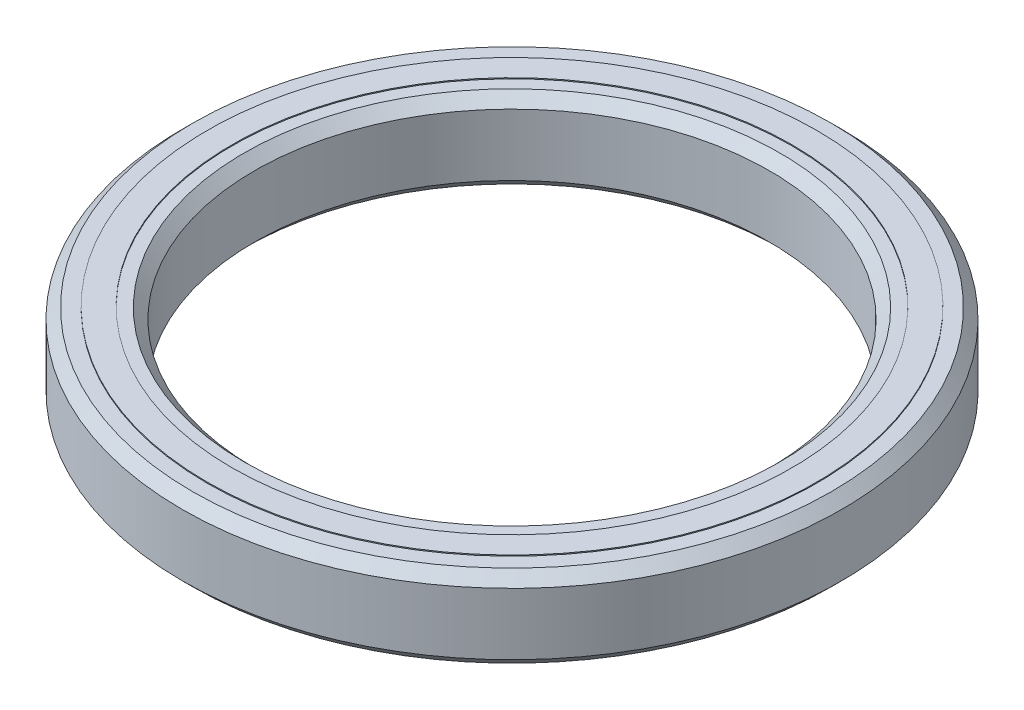
from build123d import *

# Parameters (mm, degrees)
CROQUIS1_R              = 16
CROQUIS1_R_2            = 12.5
SALIENTE_EXTRUIR1_DEPTH = 2
CHAFL_N1_SIZE           = 0.5
CROQUIS2_R              = 14.793460403
CROQUIS2_R_2            = 13.590473759
SALIENTE_EXTRUIR2_DEPTH = 2.05


with BuildPart() as part:
    # Croquis1 → Saliente-Extruir1 (new, symmetric)
    with BuildSketch(Plane(origin=(0, 0, 0), x_dir=(1, 0, 0), z_dir=(0, 1, 0))):
        Circle(CROQUIS1_R)
        Circle(CROQUIS1_R_2, mode=Mode.SUBTRACT)
    extrude(amount=SALIENTE_EXTRUIR1_DEPTH, both=True)

    # Chaflán1
    chafl_n1_edges = [part.edges().sort_by_distance(p)[0] for p in [
        (-12.5, -2, 0),
        (-12.5, 2, 0),
        (-16, -2, 0),
        (-16, 2, 0),
    ]]
    chamfer(chafl_n1_edges, length=CHAFL_N1_SIZE)

    # Croquis2 → Saliente-Extruir2 (add, symmetric)
    with BuildSketch(Plane(origin=(0, 0, 0), x_dir=(1, 0, 0), z_dir=(0, 1, 0))):
        Circle(CROQUIS2_R)
        Circle(CROQUIS2_R_2, mode=Mode.SUBTRACT)
    extrude(amount=SALIENTE_EXTRUIR2_DEPTH, both=True)


solid = part.part
